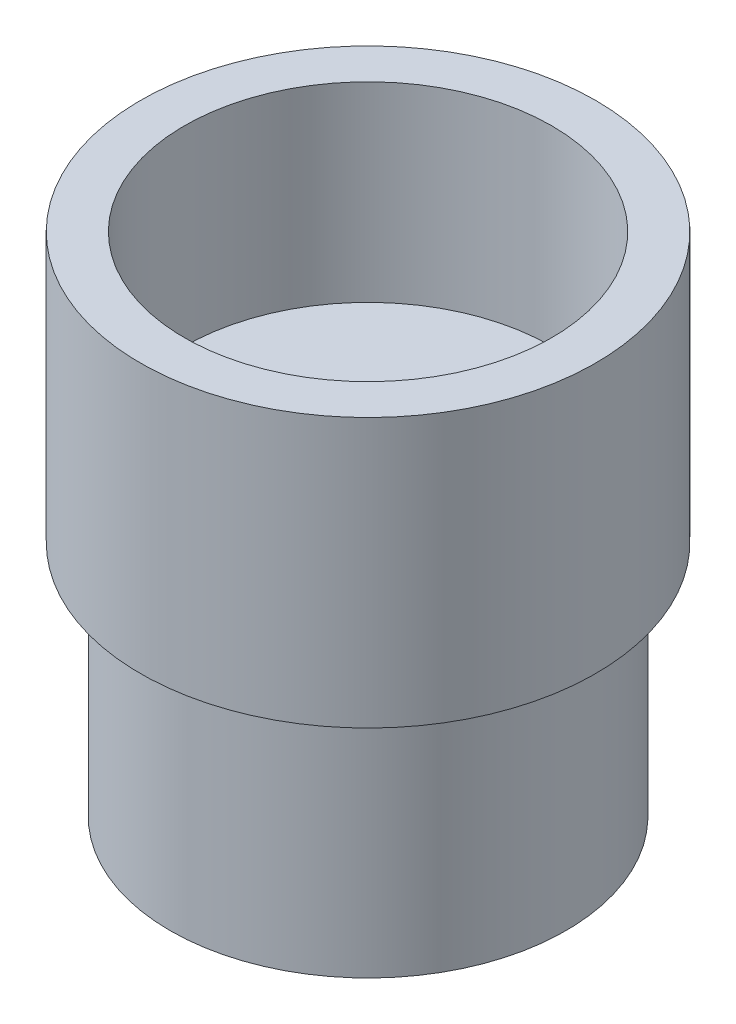
from build123d import *


with BuildPart() as part:
    # Sketch1 → Revolve1 (revolve)
    with BuildSketch(Plane.XY):
        Polygon((23.5712, 30.48), (23.5712, 0), (25.4, 0), (25.4, 30.48), (29.21, 30.48), (29.21, 65), (23.5712, 65), (23.5712, 40.48), (0, 40.48), (0, 30.48), align=None)
    revolve(axis=Axis((0, 0, 0), (0, 1, 0)))


solid = part.part
